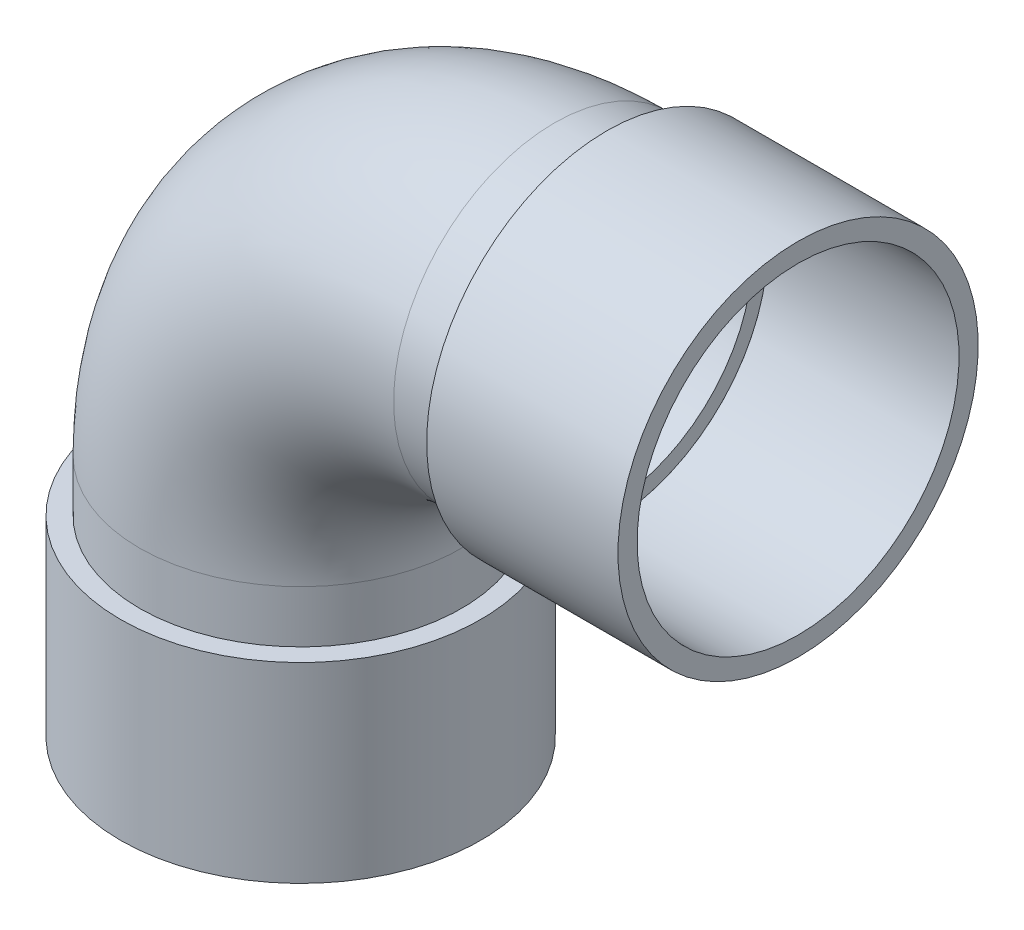
from build123d import *

# Parameters (mm, degrees)
CROQUIS3_R              = 84.15
CROQUIS3_R_2            = 76.2
CROQUIS4_R              = 94.15
CROQUIS4_R_2            = 84.15
SALIENTE_EXTRUIR1_DEPTH = 100
CROQUIS5_R              = 94.15
CROQUIS5_R_2            = 84.15
SALIENTE_EXTRUIR2_DEPTH = 100


with BuildPart() as part:
    # Barrer1: sweep along a path in Croquis2
    with BuildLine(Plane.XY) as barrer1_path:
        Line((0, 0), (0, 27.27))
        ThreePointArc((0, 27.27), (38.875716933, 121.124283067), (132.73, 160))
        Line((132.73, 160), (160, 160))
    # Croquis3 → Barrer1 (sweep)
    with BuildSketch(Plane(origin=(0, 0, 0), x_dir=(1, 0, 0), z_dir=(0, 1, 0))):
        Circle(CROQUIS3_R)
        Circle(CROQUIS3_R_2, mode=Mode.SUBTRACT)
    sweep(path=barrer1_path.line)


with BuildPart() as body_2:
    # Croquis4 → Saliente-Extruir1 (new body)
    with BuildSketch(Plane(origin=(160, 0, 0), x_dir=(0, 0, -1), z_dir=(1, 0, 0))):
        with Locations((0, 160)):
            Circle(CROQUIS4_R)
        with Locations((0, 160)):
            Circle(CROQUIS4_R_2, mode=Mode.SUBTRACT)
    extrude(amount=SALIENTE_EXTRUIR1_DEPTH)


with BuildPart() as body_3:
    # Croquis5 → Saliente-Extruir2 (new body)
    with BuildSketch(Plane.XZ):
        Circle(CROQUIS5_R)
        Circle(CROQUIS5_R_2, mode=Mode.SUBTRACT)
    extrude(amount=SALIENTE_EXTRUIR2_DEPTH)


solid = Compound([part.part, body_2.part, body_3.part])
